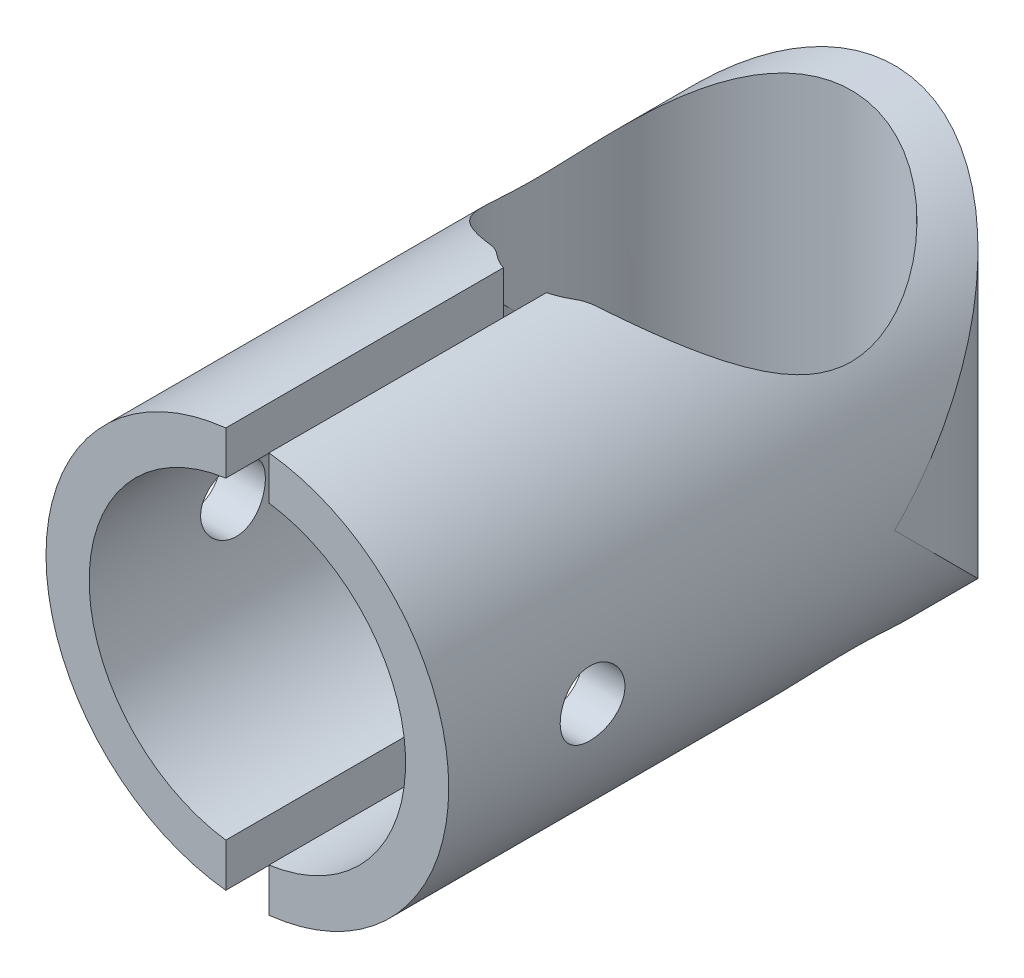
from build123d import *

# Parameters (mm, degrees)
SKETCH_1_R               = 14
EXTRUDE_1_DEPTH          = 45
CUT_EXTRUDE_1_DEPTH      = 55.817880294662984
CUT_EXTRUDE_2_DEPTH      = 55.817880455551716
CUT_EXTRUDE_3_REACH      = 51.163
CUT_EXTRUDE_3_END_RADIUS = 11
SKETCH_5_R               = 11
HOLE_WIZARD_M41_D        = 4.5
SKETCH_10_R              = 4.000000000000001
CUT_EXTRUDE_5_DEPTH      = 55.817880455551716
FILLET_2_R               = 3


with BuildPart() as part:
    # Эскиз1 → Бобышка-Вытянуть1 (new body)
    with BuildSketch(Plane.XY):
        with Locations(Location((0, 0, 0), (0, 0, 180))):
            Circle(SKETCH_1_R)
    extrude(amount=EXTRUDE_1_DEPTH)

    # Эскиз2 → Вырез-Вытянуть1 (cut, through all)
    with BuildSketch(Plane(origin=(0, 13.999999999999998, 0), x_dir=(1, 0, 0), z_dir=(0, 1, 0))):
        with BuildLine():
            Line((-1.4999999999999998, -24.897247358851686), (-1.5000000000000002, -45))
            Line((-1.5000000000000002, -45), (1.4999999999999998, -45))
            Line((1.4999999999999998, -45), (1.5000000000000002, -24.897247358851683))
            ThreePointArc((1.5000000000000002, -24.897247358851683), (-1.77e-15, -3.0000000000000018), (-1.4999999999999998, -24.897247358851686))
        make_face()
    extrude(amount=-CUT_EXTRUDE_1_DEPTH, mode=Mode.SUBTRACT)

    # Эскиз3 → Вырез-Вытянуть2 (cut, through all)
    with BuildSketch(Plane(origin=(0, 13.999999999999998, 0), x_dir=(1, 0, 0), z_dir=(0, 1, 0))):
        with BuildLine():
            Line((1.53e-15, 0), (14, 0))
            Line((14, 0), (14, -14))
            ThreePointArc((14, -14), (9.899494936611665, -4.100505063388336), (1.53e-15, 0))
        make_face()
    cut_extrude_2 = extrude(amount=-CUT_EXTRUDE_2_DEPTH, mode=Mode.SUBTRACT)

    # Зеркальное отражение1: Вырез-Вытянуть2 across plane
    add(cut_extrude_2.mirror(Plane(origin=(0, 0, 0), x_dir=(0, 0, 1), z_dir=(1, 0, 0))), mode=Mode.SUBTRACT)

    # Вырез-Вытянуть3: up to this cylinder (the profile starts outside it)
    cut_extrude_3_end = Plane(origin=(0, 0, 14), z_dir=(0, 1, 0)) * Cylinder(CUT_EXTRUDE_3_END_RADIUS, 125.326, mode=Mode.PRIVATE)
    # Эскиз5 → Вырез-Вытянуть3 (cut, up to the surface)
    with BuildSketch(Plane.XY.offset(45), mode=Mode.PRIVATE) as cut_extrude_3_sk1:
        Circle(SKETCH_5_R)
    cut_extrude_3_tool1 = extrude(cut_extrude_3_sk1.sketch, amount=-CUT_EXTRUDE_3_REACH, mode=Mode.PRIVATE) - cut_extrude_3_end
    add(cut_extrude_3_tool1.solids().sort_by_distance((0, 0, 45))[0], mode=Mode.SUBTRACT)

    # Отверстие с зазором M41 (through all)
    with Locations(Plane.ZY.offset(14)):
        with Locations((35, 0)):
            Hole(HOLE_WIZARD_M41_D / 2)

    # Эскиз10 → Вырез-Вытянуть5 (cut, through all)
    with BuildSketch(Plane(origin=(0, 13.999999999999998, 0), x_dir=(1, 0, 0), z_dir=(0, 1, 0))):
        with Locations((2.69e-15, -22)):
            Circle(SKETCH_10_R)
    extrude(amount=-CUT_EXTRUDE_5_DEPTH, mode=Mode.SUBTRACT)

    # Скругление2
    # the kernel refuses this fillet: 3 mm, written as the material it takes off along each edge
    with BuildSketch(Plane(origin=(3.0714155938264063, 8.929765892568234, 24.5625), x_dir=(0.9515151391900515, 0, -0.3076019178941137), z_dir=(0, 1, 0))) as fillet_2_piece_1:
        with BuildLine():
            CenterArc((0.7421518670144389, -2.998677814092494), FILLET_2_R, 91.70113671007151, 22.56132809094649)
            ThreePointArc((-0.49059972813456, -0.26365980598768485), (-0.24070528989536213, -0.1403791652949137), (0, 0))
            ThreePointArc((0, 0), (0.32654682148635233, -0.00484801499419387), (0.6530936429727053, 0))
        make_face()
    extrude(amount=6.361899587338076, mode=Mode.SUBTRACT)
    with BuildSketch(Plane(origin=(3.0714155938264063, -15.291665479906309, 24.5625), x_dir=(0.9515151391900515, 0, -0.3076019178941137), z_dir=(0, 1, 0))) as fillet_2_piece_2:
        with BuildLine():
            CenterArc((0.7421518670144389, -2.998677814092494), FILLET_2_R, 91.70113671007151, 22.56132809094649)
            ThreePointArc((-0.49059972813456, -0.26365980598768485), (-0.24070528989536213, -0.1403791652949137), (0, 0))
            ThreePointArc((0, 0), (0.32654682148635233, -0.00484801499419387), (0.6530936429727053, 0))
        make_face()
    extrude(amount=6.361899587338073, mode=Mode.SUBTRACT)
    with BuildSketch(Plane(origin=(-3.071415593826399, -15.291665479973231, 24.562500000000004), x_dir=(-0.951515139190051, 0, -0.30760191789411484), z_dir=(0, 1, 0))) as fillet_2_piece_3:
        with BuildLine():
            CenterArc((0.74215186701443, 2.9986778140924932), FILLET_2_R, 245.73753519898207, 22.561328090946517)
            ThreePointArc((-0.4905997281345645, 0.26365980598768285), (-0.24070528989536077, 0.14037916529491015), (0, 0))
            ThreePointArc((0, 0), (0.3265468214863568, 0.00484801499419199), (0.6530936429727027, 1e-17))
        make_face()
    extrude(amount=6.361899587404984, mode=Mode.SUBTRACT)
    with BuildSketch(Plane(origin=(-3.0714155938264005, 8.929765892568248, 24.5625), x_dir=(0.6925285774560104, 0, 0.7213904417212322), z_dir=(0, 1, 0))) as fillet_2_piece_4:
        with BuildLine():
            CenterArc((0.7658201789099277, -2.992720748753202), FILLET_2_R, 93.99216250796835, 22.561328090946503)
            ThreePointArc((-0.5752791741518538, -0.3091685273091581), (-0.28534458134091156, -0.1588546498268302), (0, 0))
            ThreePointArc((0, 0), (0.27848006505815376, -0.0097056683290632), (0.5569601301163086, 5e-17))
        make_face()
    extrude(amount=6.361899587404974, mode=Mode.SUBTRACT)


solid = part.part
